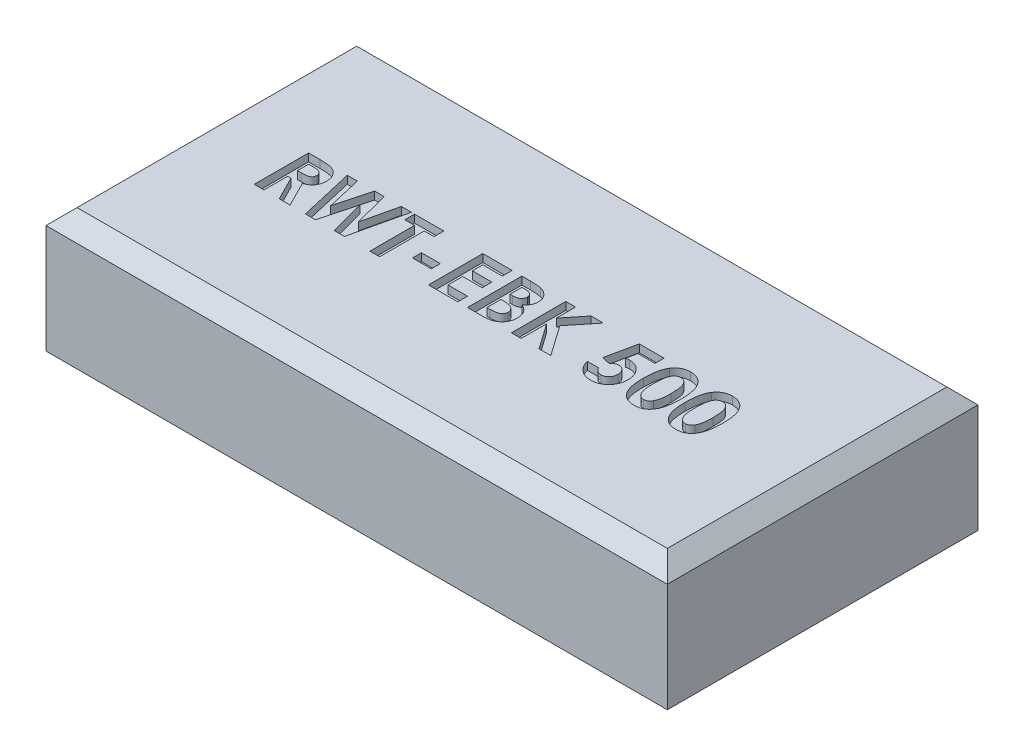
from build123d import *

# Parameters (mm, degrees)
SKETCH1_W           = 40
SKETCH1_H           = 20
BOSS_EXTRUDE1_DEPTH = 8
CHAMFER1_SIZE       = 1
SKETCH4_W           = 1.211538461
SKETCH4_H           = 0.583333333
CUT_EXTRUDE3_DEPTH  = 0.5


with BuildPart() as part:
    # Sketch1 → Boss-Extrude1 (new body)
    with BuildSketch(Plane(origin=(0, 0, 0), x_dir=(1, 0, 0), z_dir=(0, 1, 0))):
        with Locations((0, 2.318501171)):
            Rectangle(SKETCH1_W, SKETCH1_H)
    extrude(amount=BOSS_EXTRUDE1_DEPTH)

    # Chamfer1
    chamfer1_edges = [part.edges().sort_by_distance(p)[0] for p in [
        (0, 8, 7.681498829),
        (-20, 8, -2.318501171),
        (0, 8, -12.318501171),
        (20, 8, -2.318501171),
    ]]
    chamfer(chamfer1_edges, length=CHAMFER1_SIZE)

    # Sketch4 → Cut-Extrude3 (cut)
    # profile 1 of 10: a face of its own
    with BuildSketch(Plane(origin=(0, 8, 0), x_dir=(1, 0, 0), z_dir=(0, 1, 0))):
        with BuildLine():
            Line((-14.596153846, 3.818501171), (-13.864182692, 3.818501171))
            add(Edge.make_bspline(
                [(-13.864182692, 3.818501171), (-13.815799622, 3.818329439), (-13.722745349, 3.81799915), (-13.588566169, 3.81278806), (-13.46530414, 3.805536401), (-13.352776761, 3.794470177), (-13.251032173, 3.779797701), (-13.159968404, 3.76250128), (-13.079588115, 3.742788301), (-13.009213411, 3.718224373), (-12.945703721, 3.690516634), (-12.886503859, 3.658679935), (-12.830307791, 3.623068786), (-12.777491125, 3.582746162), (-12.727594872, 3.538437457), (-12.6805249, 3.49009807), (-12.636946351, 3.437318103), (-12.597129066, 3.380431058), (-12.560838815, 3.320587191), (-12.528765845, 3.257704336), (-12.502684052, 3.191738763), (-12.479637993, 3.123643816), (-12.463038663, 3.052446065), (-12.451494071, 2.978838632), (-12.443041573, 2.902562411), (-12.442555595, 2.850743733), (-12.442307692, 2.824310466)],
                knots=[0, 0, 0, 0, 1.749336639, 3.364467119, 4.854658419, 6.213483162, 7.451590619, 8.570285859, 9.5643256, 10.440900261, 11.26203566, 12.067320669, 12.869050712, 13.665104639, 14.467235401, 15.27997916, 16.102287765, 16.939272006, 17.78853747, 18.631303466, 19.488103222, 20.351255419, 21.228522269, 22.127379805, 23.044756219, 24, 24, 24, 24], degree=3))
            add(Edge.make_bspline(
                [(-12.442307692, 2.824310466), (-12.442951654, 2.796720207), (-12.444214347, 2.742620739), (-12.451015895, 2.663153032), (-12.46344699, 2.587123888), (-12.48227569, 2.514755912), (-12.503916836, 2.4451484), (-12.532694008, 2.379585653), (-12.565171892, 2.317114157), (-12.603744925, 2.258617595), (-12.646076944, 2.20279664), (-12.695308193, 2.151790002), (-12.748249241, 2.102856265), (-12.807876098, 2.059060474), (-12.871560358, 2.017441316), (-12.940567358, 1.979723274), (-13.014446736, 1.944958206), (-13.066387598, 1.925570802), (-13.092948718, 1.91565662)],
                knots=[0, 0, 0, 0, 1.099860209, 2.156625411, 3.176576793, 4.16617041, 5.135385252, 6.078461593, 7.016046972, 7.938469504, 8.868247731, 9.803980173, 10.76021508, 11.73834243, 12.748633912, 13.790971185, 14.870363756, 16, 16, 16, 16], degree=3))
            Line((-13.092948718, 1.91565662), (-12.28525641, 0.318501171))
            Line((-12.28525641, 0.318501171), (-12.983573718, 0.318501171))
            Line((-12.983573718, 0.318501171), (-13.754807692, 1.844142197))
            Line((-13.754807692, 1.844142197), (-13.967948718, 1.844142197))
            Line((-13.967948718, 1.844142197), (-13.967948718, 0.318501171))
            Line((-13.967948718, 0.318501171), (-14.596153846, 0.318501171))
            Line((-14.596153846, 0.318501171), (-14.596153846, 3.818501171))
        make_face()
        with BuildLine():
            Line((-13.967948718, 2.472347325), (-13.723257212, 2.472347325))
            add(Edge.make_bspline(
                [(-13.723257212, 2.472347325), (-13.693341641, 2.472684254), (-13.636059751, 2.473329401), (-13.55368087, 2.476321861), (-13.4788612, 2.483532211), (-13.41127944, 2.492642218), (-13.350595524, 2.503161037), (-13.297350732, 2.518235143), (-13.250724642, 2.534387429), (-13.211269776, 2.554460531), (-13.177560445, 2.577288002), (-13.148454596, 2.603220576), (-13.124379885, 2.633234229), (-13.104565169, 2.666513318), (-13.089151475, 2.70335219), (-13.07790066, 2.743346436), (-13.071613117, 2.786951643), (-13.070889714, 2.817045173), (-13.070512821, 2.832723927)],
                knots=[0, 0, 0, 0, 1.688639943, 3.233382647, 4.650958383, 5.928841754, 7.082724185, 8.122798841, 9.049171256, 9.863274652, 10.613301712, 11.341792392, 12.054588806, 12.776240173, 13.521029143, 14.301969904, 15.115324896, 16, 16, 16, 16], degree=3))
            add(Edge.make_bspline(
                [(-13.070512821, 2.832723927), (-13.071225372, 2.851273039), (-13.072625049, 2.88770933), (-13.086514186, 2.940164814), (-13.108622693, 2.988715953), (-13.1389274, 3.033143381), (-13.177092239, 3.072091531), (-13.220889403, 3.106424636), (-13.27126414, 3.133572687), (-13.317907356, 3.151479252), (-13.36034178, 3.162192934), (-13.398637509, 3.170176676), (-13.442984193, 3.175834983), (-13.493415313, 3.181836624), (-13.549802317, 3.185728385), (-13.612452548, 3.188568594), (-13.681186076, 3.189730664), (-13.729099873, 3.190102157), (-13.754106571, 3.190296043)],
                knots=[0, 0, 0, 0, 1.020303359, 2.004196876, 2.966617323, 3.9489082, 4.950758222, 5.960522915, 7.003732012, 8.091992268, 8.70421221, 9.413913587, 10.24622431, 11.166358409, 12.212345909, 13.359657661, 14.621978493, 16, 16, 16, 16], degree=3))
            Line((-13.754106571, 3.190296043), (-13.967948718, 3.190296043))
            Line((-13.967948718, 3.190296043), (-13.967948718, 2.472347325))
        make_face(mode=Mode.SUBTRACT)
    # profile 2 of 10: a face of its own
    with BuildSketch(Plane(origin=(0, 8, 0), x_dir=(1, 0, 0), z_dir=(0, 1, 0))):
        Polygon((-12.105769231, 3.818501171), (-11.457231571, 3.818501171), (-10.939102564, 1.584026011), (-10.345252404, 3.818501171), (-9.734575321, 3.818501171), (-9.144230769, 1.584026011), (-8.627504006, 3.818501171), (-7.977564103, 3.818501171), (-8.787359776, 0.318501171), (-9.443609776, 0.318501171), (-10.041666667, 2.581021203), (-10.643229167, 0.318501171), (-11.294571314, 0.318501171), align=None)
    # profile 3 of 10: a face of its own
    with BuildSketch(Plane(origin=(0, 8, 0), x_dir=(1, 0, 0), z_dir=(0, 1, 0))):
        Polygon((-7.775641026, 3.818501171), (-5.891025641, 3.818501171), (-5.891025641, 3.190296043), (-6.519230769, 3.190296043), (-6.519230769, 0.318501171), (-7.147435897, 0.318501171), (-7.147435897, 3.190296043), (-7.775641026, 3.190296043), align=None)
    # profile 4 of 10: a face of its own
    with BuildSketch(Plane(origin=(0, 8, 0), x_dir=(1, 0, 0), z_dir=(0, 1, 0))):
        with Locations((-4.791666667, 1.597347325)):
            Rectangle(SKETCH4_W, SKETCH4_H)
    # profile 5 of 10: a face of its own
    with BuildSketch(Plane(origin=(0, 8, 0), x_dir=(1, 0, 0), z_dir=(0, 1, 0))):
        Polygon((-3.378205128, 3.818501171), (-1.493589744, 3.818501171), (-1.493589744, 3.190296043), (-2.75, 3.190296043), (-2.75, 2.51721912), (-1.493589744, 2.51721912), (-1.493589744, 1.889013991), (-2.75, 1.889013991), (-2.75, 0.946706299), (-1.493589744, 0.946706299), (-1.493589744, 0.318501171), (-3.378205128, 0.318501171), align=None)
    # profile 6 of 10: a face of its own
    with BuildSketch(Plane(origin=(0, 8, 0), x_dir=(1, 0, 0), z_dir=(0, 1, 0))):
        with BuildLine():
            Line((-0.865384615, 0.318501171), (-0.865384615, 3.818501171))
            Line((-0.865384615, 3.818501171), (-0.304487179, 3.818501171))
            add(Edge.make_bspline(
                [(-0.304487179, 3.818501171), (-0.265220852, 3.818505652), (-0.189241252, 3.818514323), (-0.079622519, 3.814664873), (0.022039599, 3.809685178), (0.115421572, 3.804114058), (0.200682344, 3.794513904), (0.277692262, 3.784396391), (0.346605192, 3.772195293), (0.389210312, 3.76125053), (0.409254808, 3.756101331)],
                knots=[0, 0, 0, 0, 1.311965854, 2.538629056, 3.664479157, 4.713267157, 5.663616078, 6.530575999, 7.308677837, 8, 8, 8, 8], degree=3))
            add(Edge.make_bspline(
                [(0.409254808, 3.756101331), (0.435575266, 3.748838294), (0.487224455, 3.734585883), (0.561202576, 3.705802524), (0.631381143, 3.673807779), (0.697674471, 3.637307759), (0.759675491, 3.595861807), (0.817148578, 3.549140995), (0.871333285, 3.499020694), (0.920305637, 3.444104065), (0.964568575, 3.386074475), (1.003025131, 3.324947127), (1.03643895, 3.2616567), (1.063178757, 3.195406725), (1.083326699, 3.126502301), (1.09806282, 3.055237661), (1.107613822, 2.981387306), (1.108516267, 2.931144495), (1.108974359, 2.905640594)],
                knots=[0, 0, 0, 0, 1.099996261, 2.158545794, 3.195537121, 4.207578794, 5.205712374, 6.197378256, 7.190519799, 8.17788031, 9.159561366, 10.129234751, 11.085776129, 12.040971148, 13.00380137, 13.975669004, 14.972423361, 16, 16, 16, 16], degree=3))
            add(Edge.make_bspline(
                [(1.108974359, 2.905640594), (1.107776583, 2.872874775), (1.105418909, 2.808379286), (1.090357925, 2.713647082), (1.062116233, 2.624111532), (1.025162666, 2.538122532), (0.974917368, 2.456000819), (0.911115557, 2.377785442), (0.834790614, 2.30106803), (0.776245169, 2.255081117), (0.745793269, 2.231161427)],
                knots=[0, 0, 0, 0, 0.986156485, 1.941127874, 2.875419072, 3.804401753, 4.751181392, 5.761612777, 6.835722519, 8, 8, 8, 8], degree=3))
            add(Edge.make_bspline(
                [(0.745793269, 2.231161427), (0.770470028, 2.218564156), (0.818854324, 2.193864392), (0.887545811, 2.153265354), (0.951146629, 2.110083128), (1.009941945, 2.065186558), (1.062698461, 2.016672412), (1.111594582, 1.967336144), (1.154218027, 1.914350989), (1.192333195, 1.85960544), (1.225462281, 1.802306775), (1.254314061, 1.742551757), (1.278684124, 1.680136252), (1.299321324, 1.615377904), (1.314712554, 1.548053973), (1.324747963, 1.478140383), (1.332431699, 1.405875574), (1.333029422, 1.35665059), (1.333333333, 1.331622165)],
                knots=[0, 0, 0, 0, 1.164658916, 2.283573913, 3.35186032, 4.395461096, 5.390182219, 6.362969632, 7.312859996, 8.245001507, 9.165155236, 10.092416118, 11.032087915, 11.979892451, 12.947605196, 13.931445124, 14.948243989, 16, 16, 16, 16], degree=3))
            add(Edge.make_bspline(
                [(1.333333333, 1.331622165), (1.331361149, 1.283819302), (1.327469051, 1.189480545), (1.29901193, 1.050969584), (1.249676325, 0.91964863), (1.18342878, 0.796039608), (1.101799059, 0.683720797), (1.007948289, 0.585330494), (0.902821331, 0.502045287), (0.805829006, 0.445834233), (0.721938284, 0.40811136), (0.652453165, 0.384788701), (0.577827621, 0.363182624), (0.49669469, 0.348010391), (0.410525202, 0.334123096), (0.318478999, 0.325548791), (0.220728113, 0.319738197), (0.153588579, 0.318921849), (0.118990385, 0.318501171)],
                knots=[0, 0, 0, 0, 1.284142165, 2.534249414, 3.780121997, 5.041676246, 6.291546858, 7.49970053, 8.684500223, 9.883330709, 10.50184324, 11.153274765, 11.851151195, 12.587658647, 13.369265475, 14.195992086, 15.070362669, 16, 16, 16, 16], degree=3))
            Line((0.118990385, 0.318501171), (-0.865384615, 0.318501171))
        make_face()
        with BuildLine():
            Line((-0.237179487, 3.190296043), (-0.237179487, 2.42747553))
            Line((-0.237179487, 2.42747553), (-0.0703125, 2.42747553))
            add(Edge.make_bspline(
                [(-0.0703125, 2.42747553), (-0.047633777, 2.427673297), (-0.003853875, 2.428055074), (0.059381549, 2.432972233), (0.118180282, 2.441361212), (0.172319311, 2.453065948), (0.222302963, 2.467929257), (0.267811927, 2.485813017), (0.308646108, 2.507633149), (0.356085982, 2.540135198), (0.406233349, 2.587963419), (0.450377513, 2.657061193), (0.476378131, 2.736523371), (0.479273899, 2.792566252), (0.480769231, 2.821505979)],
                knots=[0, 0, 0, 0, 1.065314748, 2.056525647, 2.977365736, 3.853934255, 4.656397591, 5.425096493, 6.14721249, 6.826394842, 8.123232004, 9.372140726, 10.643011755, 12, 12, 12, 12], degree=3))
            add(Edge.make_bspline(
                [(0.480769231, 2.821505979), (0.479572691, 2.848612841), (0.47725923, 2.901022871), (0.451079951, 2.97461122), (0.410418355, 3.039825558), (0.362411626, 3.084459439), (0.317203962, 3.114943064), (0.278494386, 3.135015233), (0.236007719, 3.152983634), (0.188921466, 3.166722711), (0.137504514, 3.17703203), (0.082006625, 3.184602991), (0.022332045, 3.189756109), (-0.018885315, 3.190112204), (-0.040164263, 3.190296043)],
                knots=[0, 0, 0, 0, 1.347982417, 2.606269829, 3.849316587, 5.153353503, 5.842674298, 6.568177932, 7.326619318, 8.142485038, 9.012069166, 9.942760135, 10.937925643, 12, 12, 12, 12], degree=3))
            Line((-0.040164263, 3.190296043), (-0.237179487, 3.190296043))
        make_face(mode=Mode.SUBTRACT)
        with BuildLine():
            Line((-0.237179487, 1.844142197), (-0.237179487, 0.946706299))
            Line((-0.237179487, 0.946706299), (-0.056290064, 0.946706299))
            add(Edge.make_bspline(
                [(-0.056290064, 0.946706299), (-0.020527995, 0.946910607), (0.048229046, 0.947303413), (0.146723385, 0.952049449), (0.236279363, 0.960603342), (0.316659689, 0.971282188), (0.387987483, 0.985750355), (0.450021639, 1.004144774), (0.503612874, 1.02438184), (0.548439854, 1.049377018), (0.585060929, 1.078465208), (0.618107609, 1.108194036), (0.645051813, 1.142489048), (0.666370569, 1.179878054), (0.684821916, 1.219432285), (0.695950465, 1.262696318), (0.704423352, 1.308387911), (0.704889637, 1.339991798), (0.705128205, 1.356161427)],
                knots=[0, 0, 0, 0, 1.753078804, 3.370512758, 4.83203934, 6.162291463, 7.344201807, 8.395507345, 9.331626367, 10.147333109, 10.898971645, 11.62040215, 12.321813352, 13.025280112, 13.727906689, 14.453419512, 15.208716525, 16, 16, 16, 16], degree=3))
            add(Edge.make_bspline(
                [(0.705128205, 1.356161427), (0.704602095, 1.374651653), (0.703577374, 1.410665639), (0.695208464, 1.463303922), (0.67999942, 1.512445252), (0.660842888, 1.559346239), (0.634185556, 1.602327663), (0.602504228, 1.642876951), (0.564225095, 1.679620976), (0.521177978, 1.714782156), (0.470967777, 1.745567673), (0.413570936, 1.772279563), (0.348675643, 1.79458835), (0.27608088, 1.81235062), (0.196104895, 1.827425213), (0.108163951, 1.83642641), (0.012990452, 1.843120995), (-0.053004401, 1.843794061), (-0.087139423, 1.844142197)],
                knots=[0, 0, 0, 0, 0.845221588, 1.646264278, 2.427170338, 3.19324141, 3.95557735, 4.731569926, 5.540061037, 6.376114724, 7.268642756, 8.224665384, 9.265483498, 10.400594375, 11.639216012, 12.983232105, 14.439614077, 16, 16, 16, 16], degree=3))
            Line((-0.087139423, 1.844142197), (-0.237179487, 1.844142197))
        make_face(mode=Mode.SUBTRACT)
    # profile 7 of 10: a face of its own
    with BuildSketch(Plane(origin=(0, 8, 0), x_dir=(1, 0, 0), z_dir=(0, 1, 0))):
        Polygon((1.961538462, 3.818501171), (2.58974359, 3.818501171), (2.58974359, 2.586630177), (3.582532051, 3.818501171), (4.375500801, 3.818501171), (3.128205128, 2.270424248), (4.496794872, 0.318501171), (3.740284455, 0.318501171), (2.58974359, 1.959827293), (2.58974359, 0.318501171), (1.961538462, 0.318501171), align=None)
    # profile 8 of 10: a face of its own
    with BuildSketch(Plane(origin=(0, 8, 0), x_dir=(1, 0, 0), z_dir=(0, 1, 0))):
        with BuildLine():
            Line((6.694811699, 3.818501171), (8.288461538, 3.818501171))
            Line((8.288461538, 3.818501171), (8.288461538, 3.235167838))
            Line((8.288461538, 3.235167838), (7.192608173, 3.235167838))
            Line((7.192608173, 3.235167838), (7.055889423, 2.573308863))
            add(Edge.make_bspline(
                [(7.055889423, 2.573308863), (7.07451931, 2.578497522), (7.111261274, 2.588730623), (7.166613089, 2.598993128), (7.220256712, 2.605644958), (7.255457329, 2.606532224), (7.272536058, 2.606962709)],
                knots=[0, 0, 0, 0, 1.05461699, 2.079921384, 3.068411212, 4, 4, 4, 4], degree=3))
            add(Edge.make_bspline(
                [(7.272536058, 2.606962709), (7.309752396, 2.606109919), (7.383113996, 2.60442888), (7.490432708, 2.588470341), (7.593196714, 2.563336125), (7.691091546, 2.527489548), (7.784021573, 2.480834303), (7.872099445, 2.424394534), (7.955433262, 2.358071113), (8.032542665, 2.281822516), (8.103394006, 2.19809983), (8.164995206, 2.107544887), (8.217606474, 2.011448911), (8.259451659, 1.909214572), (8.292479446, 1.801483971), (8.316346062, 1.688188071), (8.330459584, 1.569192598), (8.332362706, 1.488010495), (8.333333333, 1.446606139)],
                knots=[0, 0, 0, 0, 1.01440847, 1.999622559, 2.951875003, 3.895578053, 4.836219714, 5.782137149, 6.743708247, 7.735272588, 8.734977101, 9.730283169, 10.717124674, 11.717316708, 12.737475749, 13.78628267, 14.87096371, 16, 16, 16, 16], degree=3))
            add(Edge.make_bspline(
                [(8.333333333, 1.446606139), (8.332147212, 1.404731748), (8.329806647, 1.322101333), (8.314536605, 1.200605395), (8.287584707, 1.084239715), (8.250563578, 0.972692784), (8.201790611, 0.866784445), (8.143134442, 0.765417568), (8.073603355, 0.669344566), (7.993879688, 0.579550304), (7.907209604, 0.497476624), (7.814926423, 0.425276252), (7.717678463, 0.364520223), (7.615463378, 0.31541908), (7.508867607, 0.276571129), (7.397858799, 0.248291676), (7.281897463, 0.232074981), (7.203174783, 0.229875532), (7.163161058, 0.228757581)],
                knots=[0, 0, 0, 0, 1.06808661, 2.107647099, 3.116961351, 4.110378221, 5.100014249, 6.085620622, 7.093190682, 8.119403071, 9.144090782, 10.133780668, 11.103064255, 12.062861538, 13.020824475, 13.992378307, 14.979551724, 16, 16, 16, 16], degree=3))
            add(Edge.make_bspline(
                [(7.163161058, 0.228757581), (7.127377974, 0.229672135), (7.056806245, 0.231475826), (6.952857186, 0.242562264), (6.85263875, 0.262163189), (6.756682988, 0.290530803), (6.663980283, 0.32544486), (6.575602306, 0.369111487), (6.491063405, 0.420699211), (6.410603638, 0.479266557), (6.335530363, 0.545240399), (6.267011432, 0.617460138), (6.204632023, 0.695015476), (6.149726958, 0.778863212), (6.102468347, 0.868879466), (6.060558448, 0.964003375), (6.026254775, 1.065228337), (6.008846649, 1.135403104), (6, 1.171065274)],
                knots=[0, 0, 0, 0, 1.054957082, 2.080596141, 3.077793124, 4.061112343, 5.027190972, 5.994718051, 6.962465889, 7.943658696, 8.924948258, 9.904494768, 10.875059, 11.855380583, 12.854004648, 13.869083016, 14.917087635, 16, 16, 16, 16], degree=3))
            Line((6, 1.171065274), (6.717948718, 1.171065274))
            add(Edge.make_bspline(
                [(6.717948718, 1.171065274), (6.731072838, 1.146352842), (6.756578067, 1.098327052), (6.805094652, 1.034565599), (6.859405888, 0.980192572), (6.91902186, 0.934676733), (6.98432884, 0.900577041), (7.052665694, 0.874717413), (7.124890908, 0.859774091), (7.174079467, 0.857906028), (7.198918269, 0.856962709)],
                knots=[0, 0, 0, 0, 1.104910296, 2.147267069, 3.153527244, 4.136738762, 5.099945312, 6.05603338, 7.018353, 8, 8, 8, 8], degree=3))
            add(Edge.make_bspline(
                [(7.198918269, 0.856962709), (7.216230581, 0.857614079), (7.250292846, 0.858895659), (7.300478207, 0.86567554), (7.348382339, 0.87851648), (7.394361398, 0.896298197), (7.438538895, 0.918474006), (7.48028153, 0.946469521), (7.520315551, 0.978693396), (7.558031476, 1.015670402), (7.592191233, 1.056891163), (7.622145603, 1.10118568), (7.648928941, 1.14756972), (7.668767769, 1.197880672), (7.685014092, 1.250616232), (7.696978541, 1.306174201), (7.704128648, 1.364619465), (7.704790557, 1.404518409), (7.705128205, 1.424871363)],
                knots=[0, 0, 0, 0, 0.978869489, 1.925942215, 2.855067702, 3.774946051, 4.70828698, 5.642468714, 6.60995405, 7.609372294, 8.622401667, 9.629904756, 10.629323, 11.642352373, 12.678539694, 13.745912462, 14.850161547, 16, 16, 16, 16], degree=3))
            add(Edge.make_bspline(
                [(7.705128205, 1.424871363), (7.704736326, 1.444751879), (7.703973523, 1.483449786), (7.697663464, 1.540272174), (7.68637489, 1.594186337), (7.670994112, 1.645605217), (7.651304879, 1.694216573), (7.627243321, 1.740309765), (7.598706643, 1.783651807), (7.565541639, 1.823360298), (7.530174819, 1.859782055), (7.492179491, 1.891636234), (7.451897972, 1.918072991), (7.410581959, 1.941153049), (7.366582268, 1.957950212), (7.320888274, 1.969517798), (7.27354803, 1.978005628), (7.241258277, 1.978504319), (7.224859776, 1.978757581)],
                knots=[0, 0, 0, 0, 1.166249705, 2.270133367, 3.348514167, 4.393962215, 5.415026464, 6.420877785, 7.440098956, 8.453121383, 9.451844239, 10.415694839, 11.355045125, 12.27538808, 13.187007209, 14.108269027, 15.039275622, 16, 16, 16, 16], degree=3))
            add(Edge.make_bspline(
                [(7.224859776, 1.978757581), (7.207047192, 1.978081693), (7.171346953, 1.976727067), (7.118305333, 1.965704839), (7.065903247, 1.94786674), (7.013849287, 1.923256255), (6.962660177, 1.891048895), (6.910985012, 1.853273355), (6.860553471, 1.807184883), (6.828487694, 1.772858084), (6.811899038, 1.755099729)],
                knots=[0, 0, 0, 0, 0.88288272, 1.769486374, 2.674910571, 3.623812639, 4.617874466, 5.670434592, 6.794841017, 8, 8, 8, 8], degree=3))
            Line((6.811899038, 1.755099729), (6.283253205, 1.876393799))
            Line((6.283253205, 1.876393799), (6.694811699, 3.818501171))
        make_face()
    # profile 9 of 10: a face of its own
    with BuildSketch(Plane(origin=(0, 8, 0), x_dir=(1, 0, 0), z_dir=(0, 1, 0))):
        with BuildLine():
            add(Edge.make_bspline(
                [(9.915765224, 3.908244761), (9.94617296, 3.907793349), (10.005962692, 3.906905754), (10.094021714, 3.897292372), (10.178846898, 3.882769234), (10.260770092, 3.86251452), (10.339201605, 3.835708128), (10.414712276, 3.803621336), (10.48640331, 3.764571127), (10.555188998, 3.720461909), (10.621042843, 3.670524021), (10.682382094, 3.613592251), (10.740326935, 3.550976601), (10.793623075, 3.481730434), (10.843450772, 3.406483618), (10.889646302, 3.325224221), (10.931856026, 3.237554532), (10.970553014, 3.143316345), (11.005155982, 3.04109707), (11.03430202, 2.929724208), (11.059299625, 2.809172324), (11.080399367, 2.679141347), (11.096347361, 2.539458435), (11.107096631, 2.390216385), (11.114473288, 2.231702915), (11.115075319, 2.122963977), (11.115384615, 2.067098927)],
                knots=[0, 0, 0, 0, 0.879237366, 1.728815576, 2.559023295, 3.367336655, 4.166867292, 4.954216142, 5.737608147, 6.525189134, 7.316157332, 8.124696809, 8.942788509, 9.781158001, 10.649253743, 11.551476218, 12.482711956, 13.461909668, 14.496590415, 15.601789533, 16.789733467, 18.056700938, 19.410929216, 20.8549011, 22.384193279, 24, 24, 24, 24], degree=3))
            add(Edge.make_bspline(
                [(11.115384615, 2.067098927), (11.11505035, 2.010534943), (11.114400879, 1.900632136), (11.10740328, 1.740668821), (11.095353086, 1.590343185), (11.079821925, 1.449670779), (11.058548484, 1.31872589), (11.033634327, 1.19716946), (11.004028228, 1.085045549), (10.968285448, 0.982606796), (10.929822694, 0.888203106), (10.887497509, 0.800704352), (10.842047614, 0.71987354), (10.794515494, 0.644491226), (10.742295263, 0.576779642), (10.687928626, 0.514436242), (10.629048363, 0.459835764), (10.568133562, 0.410164346), (10.502952665, 0.367238273), (10.434177868, 0.329695837), (10.360583034, 0.299244462), (10.283509672, 0.272759483), (10.201644051, 0.253746125), (10.116287005, 0.238659651), (10.026474869, 0.23032194), (9.96532715, 0.229287592), (9.933994391, 0.228757581)],
                knots=[0, 0, 0, 0, 1.643780988, 3.193836972, 4.651895693, 6.025988579, 7.305620092, 8.505800249, 9.631074763, 10.672816429, 11.65661981, 12.592235626, 13.49536222, 14.350718032, 15.179365177, 15.97804903, 16.751647189, 17.51006938, 18.259804725, 19.016521909, 19.783502495, 20.571750527, 21.382245291, 22.22305063, 23.089471752, 24, 24, 24, 24], degree=3))
            add(Edge.make_bspline(
                [(9.933994391, 0.228757581), (9.902662478, 0.229297816), (9.841283721, 0.230356128), (9.751228725, 0.238597657), (9.665419329, 0.253807241), (9.58290602, 0.272905453), (9.504263076, 0.299185861), (9.429113408, 0.330548319), (9.358034851, 0.367856509), (9.2908306, 0.410882596), (9.227730109, 0.460221675), (9.167752798, 0.515346009), (9.111031339, 0.576115872), (9.058428606, 0.643211936), (9.00908312, 0.71573861), (8.963509474, 0.794524112), (8.921735059, 0.879453732), (8.882453162, 0.970645855), (8.848322166, 1.070063741), (8.817947164, 1.17859518), (8.793064761, 1.297144871), (8.773052668, 1.425674728), (8.757075024, 1.563912456), (8.745189494, 1.711924777), (8.738153027, 1.869780633), (8.737510367, 1.978282826), (8.737179487, 2.034146203)],
                knots=[0, 0, 0, 0, 0.917216111, 1.796812873, 2.643793957, 3.46689424, 4.273913431, 5.068098542, 5.848489301, 6.620921603, 7.401012384, 8.190319798, 9.003608147, 9.831726257, 10.68377682, 11.569763213, 12.493818149, 13.453288342, 14.474581811, 15.568529029, 16.750744269, 18.018426408, 19.375425659, 20.823733699, 22.36466933, 24, 24, 24, 24], degree=3))
            add(Edge.make_bspline(
                [(8.737179487, 2.034146203), (8.737778845, 2.111763968), (8.738935314, 2.261528446), (8.753590934, 2.477894573), (8.775101668, 2.677887577), (8.80669584, 2.861172919), (8.845761597, 3.028429436), (8.895787333, 3.178555327), (8.952737994, 3.313627923), (9.001267274, 3.393645742), (9.024639423, 3.432183062)],
                knots=[0, 0, 0, 0, 1.288568992, 2.486310467, 3.599230591, 4.627010532, 5.572937695, 6.447898582, 7.252493626, 8, 8, 8, 8], degree=3))
            add(Edge.make_bspline(
                [(9.024639423, 3.432183062), (9.051815445, 3.470042113), (9.104949923, 3.544064019), (9.197857043, 3.641240945), (9.297673647, 3.72435141), (9.406449911, 3.791514551), (9.522465493, 3.844479409), (9.646716447, 3.881887892), (9.778743933, 3.903683818), (9.869409411, 3.906701743), (9.915765224, 3.908244761)],
                knots=[0, 0, 0, 0, 1.058512271, 2.069600068, 3.047294572, 4.004278952, 4.967380941, 5.939006123, 6.946246673, 8, 8, 8, 8], degree=3))
        make_face()
        with BuildLine():
            add(Edge.make_bspline(
                [(9.931189904, 3.280039632), (9.903701059, 3.278736716), (9.84980833, 3.276182308), (9.771607414, 3.254498986), (9.697868832, 3.221007927), (9.641777862, 3.180706674), (9.599794329, 3.142073089), (9.570460134, 3.107110952), (9.542171926, 3.068095726), (9.517186356, 3.023266856), (9.493593455, 2.974235095), (9.47053608, 2.920777869), (9.451635087, 2.861582152), (9.433065363, 2.797656056), (9.416796552, 2.727232193), (9.403166854, 2.649734927), (9.390989918, 2.564660285), (9.382496359, 2.471952543), (9.374577814, 2.371708697), (9.368901426, 2.263705442), (9.36652827, 2.147971914), (9.365773916, 2.068267952), (9.365384615, 2.027134985)],
                knots=[0, 0, 0, 0, 1.076674018, 2.110852608, 3.161083442, 4.239746716, 4.804137807, 5.395870207, 6.026861976, 6.692161227, 7.405688833, 8.16177676, 8.973626916, 9.841385931, 10.773283133, 11.807421078, 12.927755683, 14.143907515, 15.458935494, 16.872852025, 18.386167141, 20, 20, 20, 20], degree=3))
            add(Edge.make_bspline(
                [(9.365384615, 2.027134985), (9.366025357, 1.973845238), (9.367254027, 1.871658197), (9.373689226, 1.724709674), (9.386588049, 1.590974686), (9.40263158, 1.46954686), (9.425165374, 1.361213689), (9.451091964, 1.264950241), (9.483108996, 1.181983641), (9.520110846, 1.111114005), (9.561092062, 1.050825352), (9.605578975, 0.999579726), (9.652056964, 0.955203432), (9.70197676, 0.919157115), (9.755219267, 0.891532879), (9.81134001, 0.871663107), (9.870374652, 0.859499993), (9.910800967, 0.85781336), (9.931189904, 0.856962709)],
                knots=[0, 0, 0, 0, 1.771748488, 3.397459088, 4.888034009, 6.237357457, 7.467047327, 8.564189669, 9.548206622, 10.417051504, 11.216568818, 11.965764335, 12.669334354, 13.348544111, 14.005342236, 14.656555988, 15.322436492, 16, 16, 16, 16], degree=3))
            add(Edge.make_bspline(
                [(9.931189904, 0.856962709), (9.950879157, 0.857544788), (9.989428267, 0.858684424), (10.045641503, 0.87038264), (10.098800732, 0.889401398), (10.148745452, 0.916304766), (10.195654308, 0.950516515), (10.239298036, 0.992186986), (10.279347487, 1.041731537), (10.302680478, 1.07850092), (10.314703526, 1.097447485)],
                knots=[0, 0, 0, 0, 0.992283464, 1.942767638, 2.88273346, 3.832339453, 4.79467288, 5.803907806, 6.868395428, 8, 8, 8, 8], degree=3))
            add(Edge.make_bspline(
                [(10.314703526, 1.097447485), (10.328858639, 1.12333736), (10.358540763, 1.177626329), (10.392888969, 1.269236938), (10.421801373, 1.372558565), (10.446685858, 1.487912756), (10.463705327, 1.615754481), (10.478362473, 1.755273086), (10.485431979, 1.907171129), (10.486581872, 2.012406641), (10.487179487, 2.067098927)],
                knots=[0, 0, 0, 0, 0.710965849, 1.490837728, 2.352621235, 3.297892224, 4.334225155, 5.461620853, 6.680770821, 8, 8, 8, 8], degree=3))
            add(Edge.make_bspline(
                [(10.487179487, 2.067098927), (10.486948641, 2.122265969), (10.486504303, 2.228453106), (10.478351976, 2.380897234), (10.466999238, 2.520129644), (10.450393459, 2.645839487), (10.429027107, 2.758331932), (10.402692997, 2.857599625), (10.37164704, 2.943838204), (10.334830235, 3.016961676), (10.294053336, 3.079106596), (10.250767413, 3.132422118), (10.204789436, 3.177941565), (10.156196294, 3.215836235), (10.103863282, 3.244790606), (10.04879003, 3.265234787), (9.990863632, 3.27760283), (9.951349628, 3.279216402), (9.931189904, 3.280039632)],
                knots=[0, 0, 0, 0, 1.793836731, 3.452829483, 4.963243077, 6.335886805, 7.574563692, 8.684454726, 9.672768357, 10.54971625, 11.340229787, 12.085688095, 12.778991901, 13.440269426, 14.083255152, 14.715733572, 15.344777694, 16, 16, 16, 16], degree=3))
        make_face(mode=Mode.SUBTRACT)
    # profile 10 of 10: a face of its own
    with BuildSketch(Plane(origin=(0, 8, 0), x_dir=(1, 0, 0), z_dir=(0, 1, 0))):
        with BuildLine():
            add(Edge.make_bspline(
                [(12.608072917, 3.908244761), (12.638480652, 3.907793349), (12.698270385, 3.906905754), (12.786329406, 3.897292372), (12.871154591, 3.882769234), (12.953077785, 3.86251452), (13.031509297, 3.835708128), (13.107019968, 3.803621336), (13.178711003, 3.764571127), (13.247496691, 3.720461909), (13.313350535, 3.670524021), (13.374689786, 3.613592251), (13.432634627, 3.550976601), (13.485930767, 3.481730434), (13.535758465, 3.406483618), (13.581953994, 3.325224221), (13.624163718, 3.237554532), (13.662860706, 3.143316345), (13.697463675, 3.04109707), (13.726609713, 2.929724208), (13.751607317, 2.809172324), (13.772707059, 2.679141347), (13.788655053, 2.539458435), (13.799404323, 2.390216385), (13.80678098, 2.231702915), (13.807383012, 2.122963977), (13.807692308, 2.067098927)],
                knots=[0, 0, 0, 0, 0.879237366, 1.728815576, 2.559023295, 3.367336655, 4.166867292, 4.954216142, 5.737608147, 6.525189134, 7.316157332, 8.124696809, 8.942788509, 9.781158001, 10.649253743, 11.551476218, 12.482711956, 13.461909668, 14.496590415, 15.601789533, 16.789733467, 18.056700938, 19.410929216, 20.8549011, 22.384193279, 24, 24, 24, 24], degree=3))
            add(Edge.make_bspline(
                [(13.807692308, 2.067098927), (13.807358042, 2.010534943), (13.806708571, 1.900632136), (13.799710973, 1.740668821), (13.787660778, 1.590343185), (13.772129618, 1.449670779), (13.750856176, 1.31872589), (13.725942019, 1.19716946), (13.69633592, 1.085045549), (13.660593141, 0.982606796), (13.622130387, 0.888203106), (13.579805201, 0.800704352), (13.534355307, 0.71987354), (13.486823186, 0.644491226), (13.434602955, 0.576779642), (13.380236318, 0.514436242), (13.321356056, 0.459835764), (13.260441254, 0.410164346), (13.195260358, 0.367238273), (13.12648556, 0.329695837), (13.052890726, 0.299244462), (12.975817364, 0.272759483), (12.893951743, 0.253746125), (12.808594697, 0.238659651), (12.718782561, 0.23032194), (12.657634842, 0.229287592), (12.626302083, 0.228757581)],
                knots=[0, 0, 0, 0, 1.643780988, 3.193836972, 4.651895693, 6.025988579, 7.305620092, 8.505800249, 9.631074763, 10.672816429, 11.65661981, 12.592235626, 13.49536222, 14.350718032, 15.179365177, 15.97804903, 16.751647189, 17.51006938, 18.259804725, 19.016521909, 19.783502495, 20.571750527, 21.382245291, 22.22305063, 23.089471752, 24, 24, 24, 24], degree=3))
            add(Edge.make_bspline(
                [(12.626302083, 0.228757581), (12.59497017, 0.229297816), (12.533591414, 0.230356128), (12.443536417, 0.238597657), (12.357727022, 0.253807241), (12.275213712, 0.272905453), (12.196570768, 0.299185861), (12.1214211, 0.330548319), (12.050342543, 0.367856509), (11.983138292, 0.410882596), (11.920037802, 0.460221675), (11.86006049, 0.515346009), (11.803339031, 0.576115872), (11.750736299, 0.643211936), (11.701390812, 0.71573861), (11.655817167, 0.794524112), (11.614042751, 0.879453732), (11.574760854, 0.970645855), (11.540629858, 1.070063741), (11.510254856, 1.17859518), (11.485372454, 1.297144871), (11.46536036, 1.425674728), (11.449382717, 1.563912456), (11.437497186, 1.711924777), (11.43046072, 1.869780633), (11.429818059, 1.978282826), (11.429487179, 2.034146203)],
                knots=[0, 0, 0, 0, 0.917216111, 1.796812873, 2.643793957, 3.46689424, 4.273913431, 5.068098542, 5.848489301, 6.620921603, 7.401012384, 8.190319798, 9.003608147, 9.831726257, 10.68377682, 11.569763213, 12.493818149, 13.453288342, 14.474581811, 15.568529029, 16.750744269, 18.018426408, 19.375425659, 20.823733699, 22.36466933, 24, 24, 24, 24], degree=3))
            add(Edge.make_bspline(
                [(11.429487179, 2.034146203), (11.430086537, 2.111763968), (11.431243006, 2.261528446), (11.445898626, 2.477894573), (11.46740936, 2.677887577), (11.499003532, 2.861172919), (11.538069289, 3.028429436), (11.588095025, 3.178555327), (11.645045686, 3.313627923), (11.693574966, 3.393645742), (11.716947115, 3.432183062)],
                knots=[0, 0, 0, 0, 1.288568992, 2.486310467, 3.599230591, 4.627010532, 5.572937695, 6.447898582, 7.252493626, 8, 8, 8, 8], degree=3))
            add(Edge.make_bspline(
                [(11.716947115, 3.432183062), (11.744123137, 3.470042113), (11.797257615, 3.544064019), (11.890164735, 3.641240945), (11.989981339, 3.72435141), (12.098757603, 3.791514551), (12.214773185, 3.844479409), (12.339024139, 3.881887892), (12.471051626, 3.903683818), (12.561717103, 3.906701743), (12.608072917, 3.908244761)],
                knots=[0, 0, 0, 0, 1.058512271, 2.069600068, 3.047294572, 4.004278952, 4.967380941, 5.939006123, 6.946246673, 8, 8, 8, 8], degree=3))
        make_face()
        with BuildLine():
            add(Edge.make_bspline(
                [(12.623497596, 3.280039632), (12.596008751, 3.278736716), (12.542116023, 3.276182308), (12.463915106, 3.254498986), (12.390176524, 3.221007927), (12.334085555, 3.180706674), (12.292102022, 3.142073089), (12.262767826, 3.107110952), (12.234479618, 3.068095726), (12.209494048, 3.023266856), (12.185901148, 2.974235095), (12.162843773, 2.920777869), (12.14394278, 2.861582152), (12.125373055, 2.797656056), (12.109104244, 2.727232193), (12.095474546, 2.649734927), (12.08329761, 2.564660285), (12.074804052, 2.471952543), (12.066885506, 2.371708697), (12.061209118, 2.263705442), (12.058835962, 2.147971914), (12.058081608, 2.068267952), (12.057692308, 2.027134985)],
                knots=[0, 0, 0, 0, 1.076674018, 2.110852608, 3.161083442, 4.239746716, 4.804137807, 5.395870207, 6.026861976, 6.692161227, 7.405688833, 8.16177676, 8.973626916, 9.841385931, 10.773283133, 11.807421078, 12.927755683, 14.143907515, 15.458935494, 16.872852025, 18.386167141, 20, 20, 20, 20], degree=3))
            add(Edge.make_bspline(
                [(12.057692308, 2.027134985), (12.05833305, 1.973845238), (12.05956172, 1.871658197), (12.065996919, 1.724709674), (12.078895741, 1.590974686), (12.094939272, 1.46954686), (12.117473067, 1.361213689), (12.143399656, 1.264950241), (12.175416688, 1.181983641), (12.212418538, 1.111114005), (12.253399754, 1.050825352), (12.297886667, 0.999579726), (12.344364656, 0.955203432), (12.394284452, 0.919157115), (12.44752696, 0.891532879), (12.503647703, 0.871663107), (12.562682345, 0.859499993), (12.603108659, 0.85781336), (12.623497596, 0.856962709)],
                knots=[0, 0, 0, 0, 1.771748488, 3.397459088, 4.888034009, 6.237357457, 7.467047327, 8.564189669, 9.548206622, 10.417051504, 11.216568818, 11.965764335, 12.669334354, 13.348544111, 14.005342236, 14.656555988, 15.322436492, 16, 16, 16, 16], degree=3))
            add(Edge.make_bspline(
                [(12.623497596, 0.856962709), (12.64318685, 0.857544788), (12.681735959, 0.858684424), (12.737949195, 0.87038264), (12.791108425, 0.889401398), (12.841053145, 0.916304766), (12.887962, 0.950516515), (12.931605729, 0.992186986), (12.971655179, 1.041731537), (12.994988171, 1.07850092), (13.007011218, 1.097447485)],
                knots=[0, 0, 0, 0, 0.992283464, 1.942767638, 2.88273346, 3.832339453, 4.79467288, 5.803907806, 6.868395428, 8, 8, 8, 8], degree=3))
            add(Edge.make_bspline(
                [(13.007011218, 1.097447485), (13.021166331, 1.12333736), (13.050848455, 1.177626329), (13.085196661, 1.269236938), (13.114109066, 1.372558565), (13.13899355, 1.487912756), (13.156013019, 1.615754481), (13.170670165, 1.755273086), (13.177739671, 1.907171129), (13.178889565, 2.012406641), (13.179487179, 2.067098927)],
                knots=[0, 0, 0, 0, 0.710965849, 1.490837728, 2.352621235, 3.297892224, 4.334225155, 5.461620853, 6.680770821, 8, 8, 8, 8], degree=3))
            add(Edge.make_bspline(
                [(13.179487179, 2.067098927), (13.179256334, 2.122265969), (13.178811995, 2.228453106), (13.170659668, 2.380897234), (13.15930693, 2.520129644), (13.142701151, 2.645839487), (13.121334799, 2.758331932), (13.095000689, 2.857599625), (13.063954732, 2.943838204), (13.027137927, 3.016961676), (12.986361029, 3.079106596), (12.943075106, 3.132422118), (12.897097128, 3.177941565), (12.848503986, 3.215836235), (12.796170975, 3.244790606), (12.741097722, 3.265234787), (12.683171324, 3.27760283), (12.64365732, 3.279216402), (12.623497596, 3.280039632)],
                knots=[0, 0, 0, 0, 1.793836731, 3.452829483, 4.963243077, 6.335886805, 7.574563692, 8.684454726, 9.672768357, 10.54971625, 11.340229787, 12.085688095, 12.778991901, 13.440269426, 14.083255152, 14.715733572, 15.344777694, 16, 16, 16, 16], degree=3))
        make_face(mode=Mode.SUBTRACT)
    extrude(amount=-CUT_EXTRUDE3_DEPTH, mode=Mode.SUBTRACT)


solid = part.part
